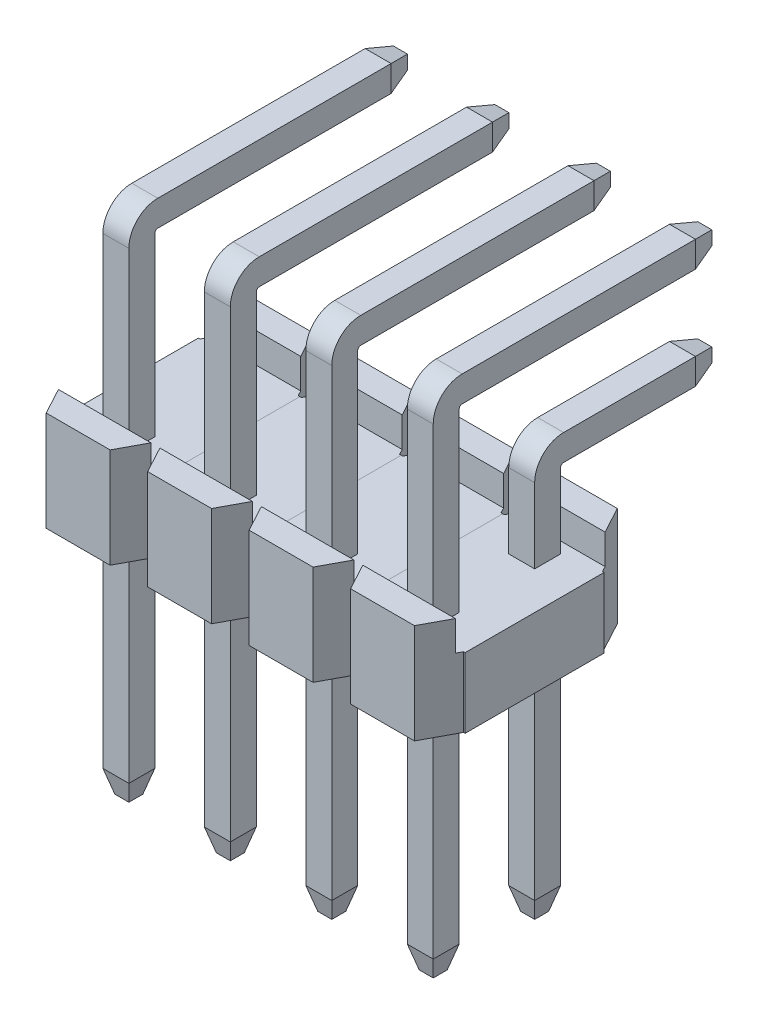
from build123d import *

# Parameters (mm, degrees)
EXTRUDE_START          = -4.06
EXTRUDE_2_DEPTH        = 2.5
CUT_EXTRUDE_START      = -4.06
SKETCH_6_W             = 2.54
SKETCH_6_H             = 3.75
CUT_EXTRUDE_1_DEPTH    = 0.75
SKETCH_2_W             = 0.65
SKETCH_2_H             = 0.65
SKETCH_4_W             = 0.65
SKETCH_4_H             = 0.65
CHAMFER_5_SIZE         = 0.15
CHAMFER_5_SIZE2        = 0.559807621
CHAMFER_6_SIZE         = 0.15
CHAMFER_6_SIZE2        = 0.559807621
CHAMFER_7_SIZE         = 0.15
CHAMFER_7_SIZE2        = 0.559807621
CHAMFER_8_SIZE         = 0.15
CHAMFER_8_SIZE2        = 0.559807621
PATTERN_LINEAR_1_COUNT = 4
PATTERN_LINEAR_1_PITCH = 2.54


with BuildPart() as part:
    # Эскиз1 → Бобышка-Вытянуть2 (new body)
    with BuildSketch(Plane(origin=(0, 0, 0), x_dir=(1, 0, 0), z_dir=(0, 1, 0)).offset(EXTRUDE_START)):
        Polygon((-0.8, -5.08), (0.8, -5.08), (1.23, -4.28), (1.27, -4.28), (1.27, -0.8), (1.23, -0.8), (0.8, 0), (-0.8, 0), (-1.23, -0.8), (-1.27, -0.8), (-1.27, -4.28), (-1.23, -4.28), align=None)
    extrude(amount=-EXTRUDE_2_DEPTH)

    # Эскиз6 → Вырез-Вытянуть1 (cut)
    with BuildSketch(Plane(origin=(0, 0, 0), x_dir=(1, 0, 0), z_dir=(0, 1, 0)).offset(CUT_EXTRUDE_START)):
        with Locations((0, -2.54)):
            Rectangle(SKETCH_6_W, SKETCH_6_H)
    extrude(amount=-CUT_EXTRUDE_1_DEPTH, mode=Mode.SUBTRACT)

    # По траектории7: sweep along a path in Эскиз3
    with BuildLine(Plane(origin=(0, 0, 0), x_dir=(0, 0, -1), z_dir=(1, 0, 0))) as sweep_7_path:
        Line((2.99, 0), (-3.41, 0))
        ThreePointArc((-3.41, 0), (-3.692842712, -0.117157288), (-3.81, -0.4))
        Line((-3.81, -0.4), (-3.81, -12.56))
    # Эскиз2 → По траектории7 (sweep)
    with BuildSketch(Plane(origin=(0, -12.56, 0), x_dir=(1, 0, 0), z_dir=(0, 1, 0))):
        with Locations((0, -3.81)):
            Rectangle(SKETCH_2_W, SKETCH_2_H)
    sweep(path=sweep_7_path.line)

    # По траектории8: sweep along a path in Эскиз5
    with BuildLine(Plane(origin=(0, 0, 0), x_dir=(0, 0, -1), z_dir=(1, 0, 0))) as sweep_8_path:
        Line((-1.27, -12.56), (-1.27, -2.94))
        ThreePointArc((-1.27, -2.94), (-1.152842712, -2.657157288), (-0.87, -2.54))
        Line((-0.87, -2.54), (2.99, -2.54))
    # Эскиз4 → По траектории8 (sweep)
    with BuildSketch(Plane(origin=(0, -12.56, 0), x_dir=(1, 0, 0), z_dir=(0, 1, 0))):
        with Locations((0, -1.27)):
            Rectangle(SKETCH_4_W, SKETCH_4_H)
    sweep(path=sweep_8_path.line)

    # Фаска5
    chamfer_5_edges = [part.edges().sort_by_distance(p)[0] for p in [
        (0, -2.215, -2.99),
        (0.325, -2.54, -2.99),
        (0, -2.865, -2.99),
        (-0.325, -2.54, -2.99),
    ]]
    chamfer_5_side = [part.faces().sort_by_distance(p)[0] for p in [
        (0, -2.54, -2.99),
    ]]
    chamfer(chamfer_5_edges, length=CHAMFER_5_SIZE, length2=CHAMFER_5_SIZE2, reference=chamfer_5_side[0])

    # Фаска6
    chamfer_6_edges = [part.edges().sort_by_distance(p)[0] for p in [
        (0.325, 0, -2.99),
        (0, 0.325, -2.99),
        (-0.325, 0, -2.99),
        (0, -0.325, -2.99),
    ]]
    chamfer_6_side = [part.faces().sort_by_distance(p)[0] for p in [
        (0, 0, -2.99),
    ]]
    chamfer(chamfer_6_edges, length=CHAMFER_6_SIZE, length2=CHAMFER_6_SIZE2, reference=chamfer_6_side[0])

    # Фаска7
    chamfer_7_edges = [part.edges().sort_by_distance(p)[0] for p in [
        (0.325, -12.56, 3.81),
        (0, -12.56, 3.485),
        (-0.325, -12.56, 3.81),
        (0, -12.56, 4.135),
    ]]
    chamfer_7_side = [part.faces().sort_by_distance(p)[0] for p in [
        (0, -12.56, 3.81),
    ]]
    chamfer(chamfer_7_edges, length=CHAMFER_7_SIZE, length2=CHAMFER_7_SIZE2, reference=chamfer_7_side[0])

    # Фаска8
    chamfer_8_edges = [part.edges().sort_by_distance(p)[0] for p in [
        (0.325, -12.56, 1.27),
        (0, -12.56, 0.945),
        (-0.325, -12.56, 1.27),
        (0, -12.56, 1.595),
    ]]
    chamfer_8_side = [part.faces().sort_by_distance(p)[0] for p in [
        (0, -12.56, 1.27),
    ]]
    chamfer(chamfer_8_edges, length=CHAMFER_8_SIZE, length2=CHAMFER_8_SIZE2, reference=chamfer_8_side[0])


with BuildPart() as pattern_linear_1_1:
    # Линейный массив1: pattern copy
    add(part.part.moved(Location(Vector(-1, 0, 0) * (1 * PATTERN_LINEAR_1_PITCH))))


with BuildPart() as pattern_linear_1_2:
    # Линейный массив1: pattern copy
    add(part.part.moved(Location(Vector(-1, 0, 0) * (2 * PATTERN_LINEAR_1_PITCH))))


with BuildPart() as pattern_linear_1_3:
    # Линейный массив1: pattern copy
    add(part.part.moved(Location(Vector(-1, 0, 0) * (3 * PATTERN_LINEAR_1_PITCH))))


solid = Compound([part.part, pattern_linear_1_1.part, pattern_linear_1_2.part, pattern_linear_1_3.part])
